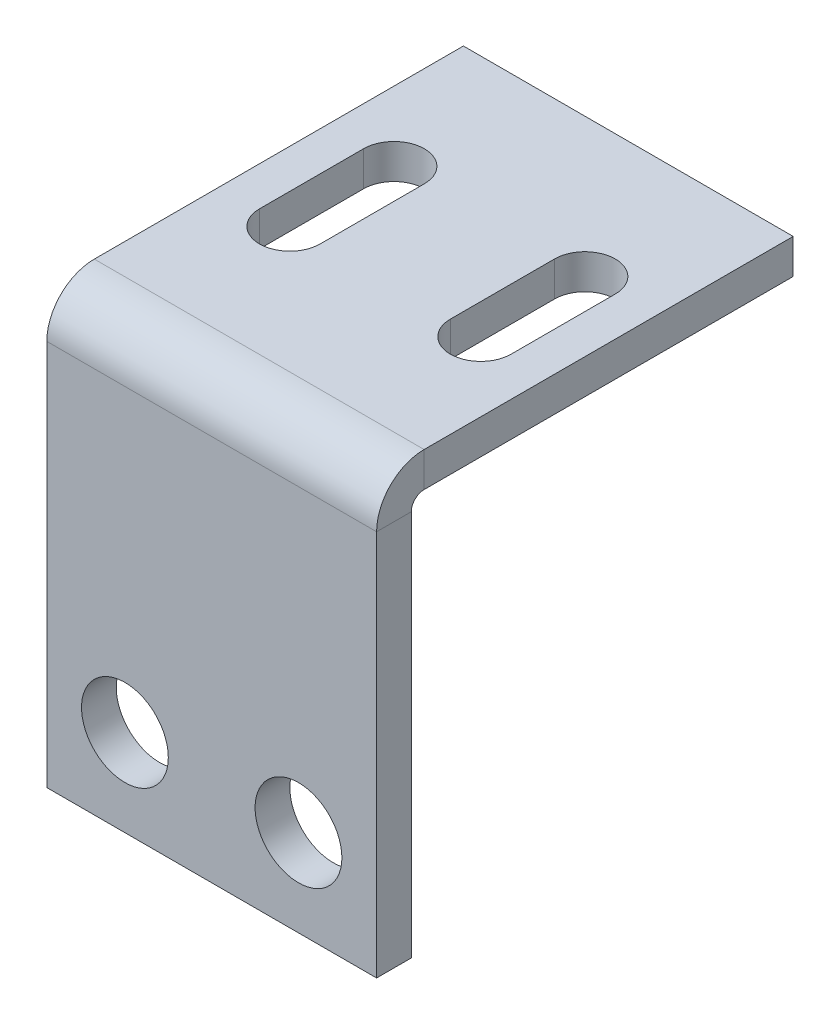
from build123d import *

# Parameters (mm, degrees)
SKETCH_1_W                       = 19
SKETCH_1_H                       = 25
SKETCH_1_R                       = 2.5
SM_BASE_FLANGE_1_DEPTH           = 2
SM_EDGE_FLANGE_1_STRIP_W         = 9.4732
SM_EDGE_FLANGE_1_STRIP_H         = 2
SM_EDGE_FLANGE_1_STRIP_CUT_DEPTH = 19
SM_EDGE_FLANGE_1_DEPTH           = 19
CUT_EXTRUDE_1_DEPTH              = 10


# Sheet-metal steps are written as plain solids
with BuildPart() as part:
    # Sketch 1 → 基体-法兰1 (new body)
    with BuildSketch(Plane.XY):
        Rectangle(SKETCH_1_W, SKETCH_1_H)
        with Locations((-5, -7.5)):
            Circle(SKETCH_1_R, mode=Mode.SUBTRACT)
        with Locations((5, -7.5)):
            Circle(SKETCH_1_R, mode=Mode.SUBTRACT)
    extrude(amount=-SM_BASE_FLANGE_1_DEPTH)

    # 边线-法兰1 strip (across the edge) → 边线-法兰1 strip cut (cut)
    with BuildSketch(Plane(origin=(-9.5, 12.5, -2), x_dir=(0, -1, 0), z_dir=(1, 0, 0))):
        with Locations((-2, -1)):
            Rectangle(SM_EDGE_FLANGE_1_STRIP_W, SM_EDGE_FLANGE_1_STRIP_H)
    extrude(amount=SM_EDGE_FLANGE_1_STRIP_CUT_DEPTH, mode=Mode.SUBTRACT)

    # 边线-法兰1 section (across the edge) → 边线-法兰1 (add)
    with BuildSketch(Plane(origin=(-9.5, 12.5, -2), x_dir=(0, -1, 0), z_dir=(1, 0, 0))):
        with BuildLine():
            Line((0, 0.7366), (0, 22))
            Line((0, 22), (2, 22))
            Line((2, 22), (2, 0.7366))
            ThreePointArc((2, 0.7366), (2.215745145, 0.215745145), (2.7366, 0))
            Line((2.7366, 0), (2.7366, -2))
            ThreePointArc((2.7366, -2), (0.801531583, -1.198468417), (0, 0.7366))
        make_face()
    extrude(amount=SM_EDGE_FLANGE_1_DEPTH)

    # 草图6 → 切除-拉伸1 (cut)
    with BuildSketch(Plane(origin=(0, 12.5, 0), x_dir=(1, 0, 0), z_dir=(0, 1, 0))):
        with BuildLine():
            Line((-7.25, 10), (-7.25, 16))
            ThreePointArc((-7.25, 16), (-5.5, 17.75), (-3.75, 16))
            Line((-3.75, 16), (-3.75, 10))
            ThreePointArc((-3.75, 10), (-5.5, 8.25), (-7.25, 10))
        make_face()
        with BuildLine():
            Line((3.75, 10), (3.75, 16))
            ThreePointArc((3.75, 16), (5.5, 17.75), (7.25, 16))
            Line((7.25, 16), (7.25, 10))
            ThreePointArc((7.25, 10), (5.5, 8.25), (3.75, 10))
        make_face()
    extrude(amount=-CUT_EXTRUDE_1_DEPTH, mode=Mode.SUBTRACT)


solid = part.part
